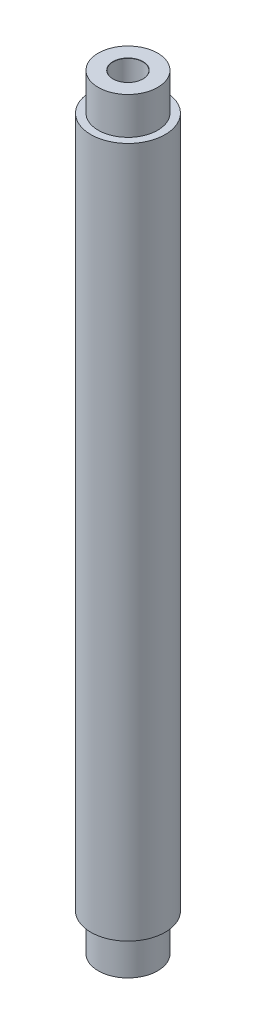
from build123d import *

# Parameters (mm, degrees)
SKETCH1_R           = 5
BOSS_EXTRUDE1_DEPTH = 103
SKETCH5_W           = 1
SKETCH5_H           = 5


with BuildPart() as part:
    # Sketch1 → Boss-Extrude1 (new body)
    with BuildSketch(Plane(origin=(0, 0, 0), x_dir=(1, 0, 0), z_dir=(0, 1, 0))):
        Circle(SKETCH1_R)
    extrude(amount=BOSS_EXTRUDE1_DEPTH)

    # Sketch4 → Ø4.0mm Dowel Hole1 (revolve, cut)
    with BuildSketch(Plane(origin=(0, 103, 0), x_dir=(0, 0, 1), z_dir=(1, 0, 0))):
        Polygon((0, 0), (0, 19.201721238), (2, 18), (2, 0.025), (2.025, 0), align=None)
    f_4_0mm_dowel_hole1 = revolve(axis=Axis((0, 109.35, 0), (0, -1, 0)), mode=Mode.SUBTRACT)

    # Mirror1: Ø4.0mm Dowel Hole1 across plane
    add(f_4_0mm_dowel_hole1.mirror(Plane.ZX.offset(51.5)), mode=Mode.SUBTRACT)

    # Sketch5 → Cut-Revolve2 (revolve, cut)
    with BuildSketch(Plane.XY):
        with Locations((-4.5, 100.5)):
            Rectangle(SKETCH5_W, SKETCH5_H)
        with Locations((-4.5, 2.5)):
            Rectangle(SKETCH5_W, SKETCH5_H)
    revolve(axis=Axis((0, 103, 0), (0, -1, 0)), mode=Mode.SUBTRACT)


solid = part.part
